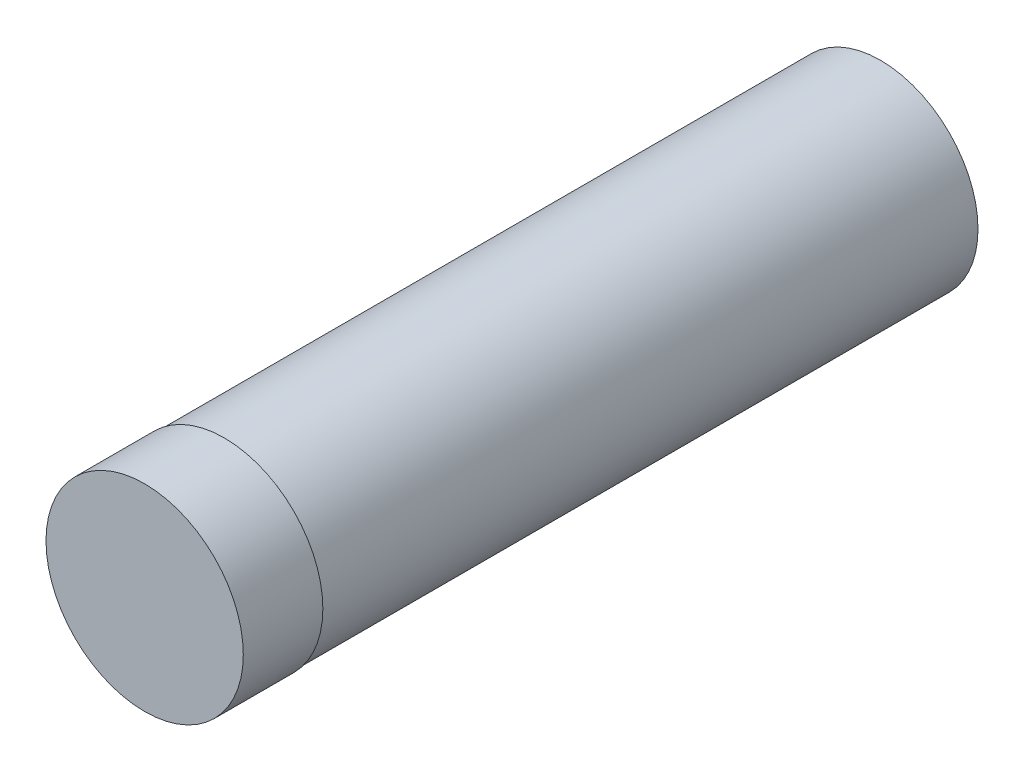
from build123d import *

# Parameters (mm, degrees)
SKETCH1_R           = 2.45
BOSS_EXTRUDE1_DEPTH = 9.25
SKETCH3_R           = 2.48
BOSS_EXTRUDE2_DEPTH = 2


with BuildPart() as part:
    # Sketch1 → Boss-Extrude1 (new, symmetric)
    with BuildSketch(Plane.XY):
        Circle(SKETCH1_R)
    extrude(amount=BOSS_EXTRUDE1_DEPTH, both=True)

    # Sketch3 → Boss-Extrude2 (add)
    with BuildSketch(Plane.XY.offset(9.25)):
        Circle(SKETCH3_R)
    extrude(amount=-BOSS_EXTRUDE2_DEPTH)


solid = part.part
